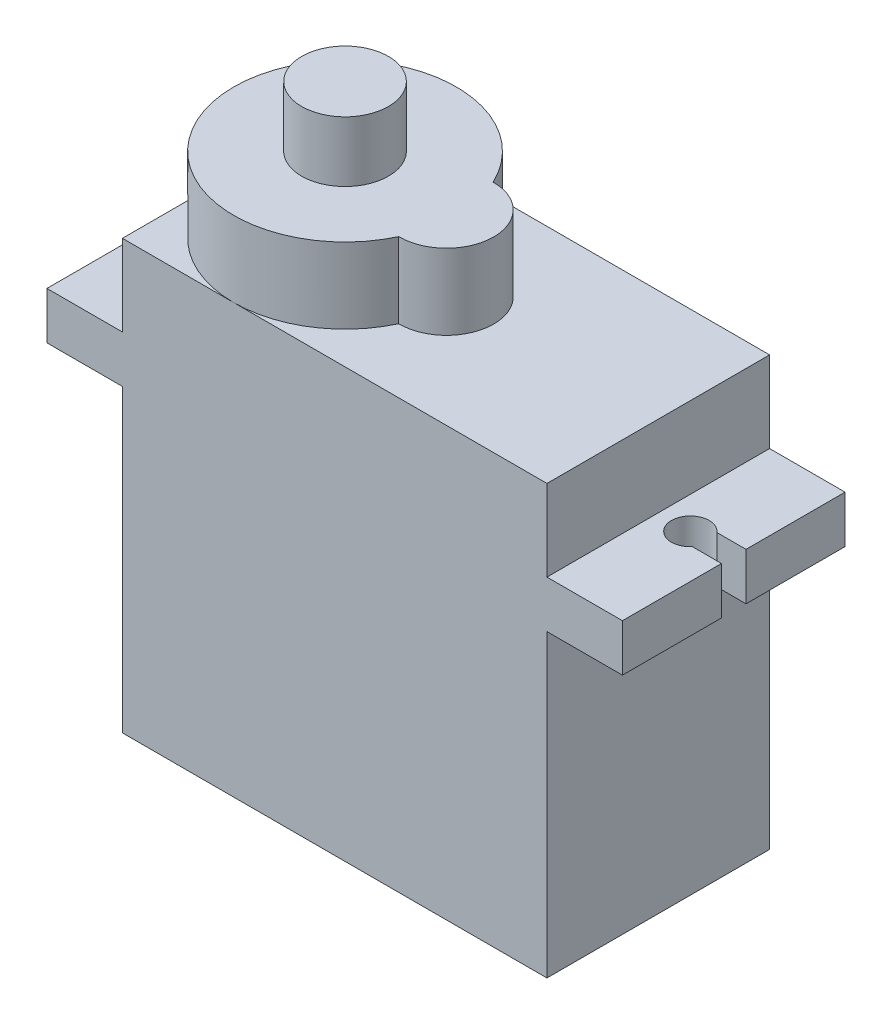
from build123d import *

# Parameters (mm, degrees)
SKETCH2_W                = 22.5
SKETCH2_H                = 22.7
BOSS_EXTRUDE1_DEPTH      = 11.8
BOSS_EXTRUDE2_DEPTH      = 4
SKETCH4_R                = 2.3
BOSS_EXTRUDE3_DEPTH      = 3.2
BOSS_EXTRUDE4_DEPTH      = 4
BOSS_EXTRUDE4_DEPTH_BACK = 26.5
SKETCH5_W                = 11.8
SKETCH5_H                = 2.5
CUT_EXTRUDE1_REACH       = 32.014


with BuildPart() as part:
    # Sketch2 → Boss-Extrude1 (new body)
    with BuildSketch(Plane.XY):
        with Locations((5.317300213, 3.518634424)):
            Rectangle(SKETCH2_W, SKETCH2_H)
    extrude(amount=BOSS_EXTRUDE1_DEPTH)

    # Sketch3 → Boss-Extrude2 (add)
    with BuildSketch(Plane(origin=(0, 14.868634424, 0), x_dir=(1, 0, 0), z_dir=(0, 1, 0))):
        with BuildLine():
            ThreePointArc((5.31155509, -3.400212046), (-5.932699787, -5.9), (5.31155509, -8.399787954))
            ThreePointArc((5.31155509, -8.399787954), (7.844115569, -5.9), (5.31155509, -3.400212046))
        make_face()
    extrude(amount=BOSS_EXTRUDE2_DEPTH)

    # Sketch4 → Boss-Extrude3 (add)
    with BuildSketch(Plane(origin=(0, 18.868634424, 0), x_dir=(1, 0, 0), z_dir=(0, 1, 0))):
        with Locations((-0.032699787, -5.9)):
            Circle(SKETCH4_R)
    extrude(amount=BOSS_EXTRUDE3_DEPTH)

    # Sketch5 → Boss-Extrude4 (add, two sides: drawn at the far end of the back side and taken through both)
    with BuildSketch(Plane(origin=(16.567300213, 0, 0), x_dir=(0, 0, -1), z_dir=(1, 0, 0)).offset(-BOSS_EXTRUDE4_DEPTH_BACK)):
        with Locations((-5.9, 9.318634424)):
            Rectangle(SKETCH5_W, SKETCH5_H)
    extrude(amount=BOSS_EXTRUDE4_DEPTH + BOSS_EXTRUDE4_DEPTH_BACK)

    # Sketch7 → Cut-Extrude1 (cut, up to next)
    with BuildSketch(Plane(origin=(0, 10.568634424, 0), x_dir=(1, 0, 0), z_dir=(0, 1, 0)), mode=Mode.PRIVATE) as cut_extrude1_sk1:
        with BuildLine():
            Line((20.567300213, -6.55), (20.567300213, -5.25))
            Line((20.567300213, -5.25), (19.027234421, -5.25))
            ThreePointArc((19.027234421, -5.25), (17.267300213, -5.9), (19.027234421, -6.55))
            Line((19.027234421, -6.55), (20.567300213, -6.55))
        make_face()
    cut_extrude1_tool1 = extrude(cut_extrude1_sk1.sketch, amount=-CUT_EXTRUDE1_REACH, mode=Mode.PRIVATE) & part.part
    # Sketch7 → Cut-Extrude1 (cut, up to next)
    with BuildSketch(Plane(origin=(0, 10.568634424, 0), x_dir=(1, 0, 0), z_dir=(0, 1, 0)), mode=Mode.PRIVATE) as cut_extrude1_sk2:
        with BuildLine():
            Line((-8.392633994, -4.9), (-9.932699787, -4.9))
            Line((-9.932699787, -4.9), (-9.932699787, -6.2))
            Line((-9.932699787, -6.2), (-8.392633994, -6.2))
            ThreePointArc((-8.392633994, -6.2), (-6.632699787, -5.55), (-8.392633994, -4.9))
        make_face()
    cut_extrude1_tool2 = extrude(cut_extrude1_sk2.sketch, amount=-CUT_EXTRUDE1_REACH, mode=Mode.PRIVATE) & part.part
    add(cut_extrude1_tool1.solids().sort_by_distance((18.851481, 10.568634, 5.9))[0], mode=Mode.SUBTRACT)
    add(cut_extrude1_tool2.solids().sort_by_distance((-8.216881, 10.568634, 5.55))[0], mode=Mode.SUBTRACT)


solid = part.part
